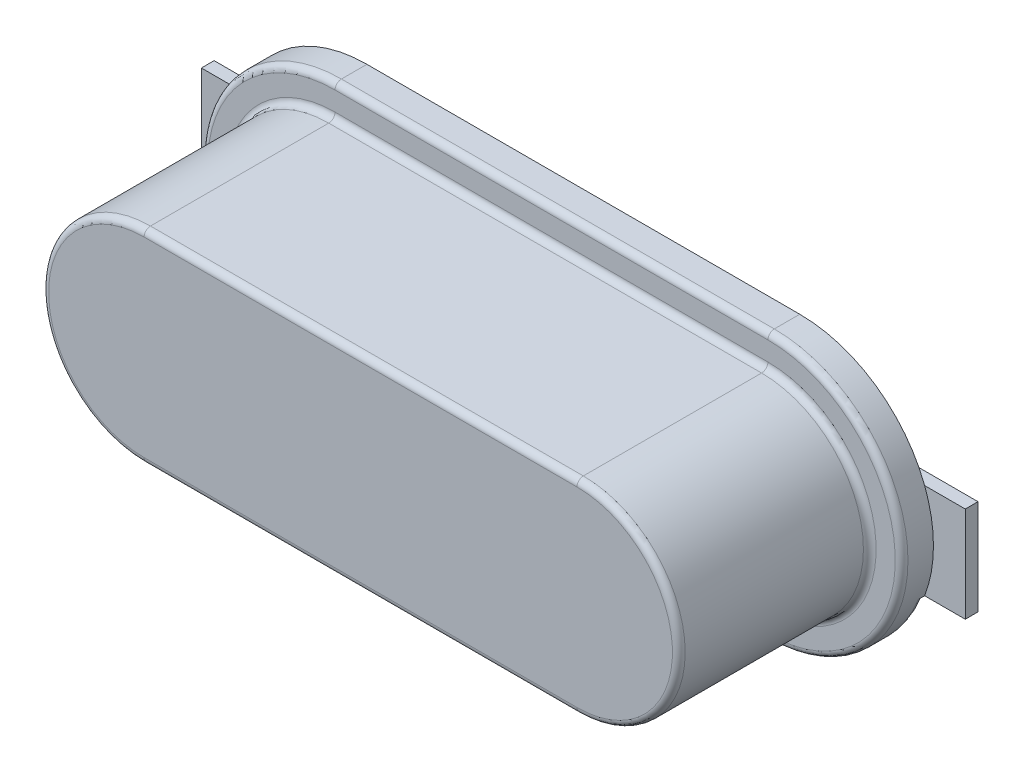
from build123d import *

# Parameters (mm, degrees)
EXTRUDE_1_DEPTH = 0.5
EXTRUDE_2_DEPTH = 3
SKETCH_3_W      = 3.5
SKETCH_3_H      = 1.5
EXTRUDE_3_DEPTH = 0.2
FILLET_1_R      = 0.1


with BuildPart() as part:
    # 草图1 → 凸台-拉伸1 (new body)
    with BuildSketch(Plane.XY):
        with BuildLine():
            Line((3.4, 2.1), (-3.4, 2.1))
            ThreePointArc((-3.4, 2.1), (-5.5, 0), (-3.4, -2.1))
            Line((-3.4, -2.1), (3.4, -2.1))
            ThreePointArc((3.4, -2.1), (5.5, 0), (3.4, 2.1))
        make_face()
    extrude(amount=EXTRUDE_1_DEPTH)

    # 草图2 → 凸台-拉伸2 (add)
    with BuildSketch(Plane.XY.offset(0.5)):
        with BuildLine():
            Line((-3.4, 1.6), (3.4, 1.6))
            ThreePointArc((3.4, 1.6), (5, 0), (3.4, -1.6))
            Line((3.4, -1.6), (-3.4, -1.6))
            ThreePointArc((-3.4, -1.6), (-5, 0), (-3.4, 1.6))
        make_face()
    extrude(amount=EXTRUDE_2_DEPTH)

    # 草图3 → 凸台-拉伸3 (add)
    with BuildSketch(Plane(origin=(0, 0, 0), x_dir=(-1, 0, 0), z_dir=(0, 0, -1))):
        with Locations((-4.25, 0)):
            Rectangle(SKETCH_3_W, SKETCH_3_H)
        with Locations((4.25, 0)):
            Rectangle(SKETCH_3_W, SKETCH_3_H)
    extrude(amount=EXTRUDE_3_DEPTH)

    # 圆角1
    # the kernel refuses this fillet: 0.1 mm, written as the material it adds along each edge
    with BuildSketch(Plane(origin=(3.4, 0, 0.5), x_dir=(0, 1, 0), z_dir=(-1, 0, 0))) as fillet_1_piece_1:
        with BuildLine():
            CenterArc((1.6 + FILLET_1_R, -FILLET_1_R), FILLET_1_R, 90, 90)
            Line((1.6, -FILLET_1_R), (1.6, 0))
            Line((1.6, 0), (1.6 + FILLET_1_R, 0))
        make_face()
    revolve(axis=Axis((3.4, 0, 0.5), (0, 0, -1)), revolution_arc=180)
    with BuildSketch(Plane(origin=(-3.4, 1.6, 0.5), x_dir=(0, 1, 0), z_dir=(1, 0, 0)), Plane(origin=(3.4, -1.6, 0.5), x_dir=(0, -1, 0), z_dir=(-1, 0, 0))) as fillet_1_piece_2:
        with BuildLine():
            CenterArc((FILLET_1_R, FILLET_1_R), FILLET_1_R, 180, 90)
            Line((0, FILLET_1_R), (0, 0))
            Line((0, 0), (FILLET_1_R, 0))
        make_face()
    extrude(amount=6.8)
    with BuildSketch(Plane(origin=(-3.4, 0, 0.5), x_dir=(0, -1, 0), z_dir=(1, 0, 0))) as fillet_1_piece_3:
        with BuildLine():
            CenterArc((1.6 + FILLET_1_R, -FILLET_1_R), FILLET_1_R, 90, 90)
            Line((1.6, -FILLET_1_R), (1.6, 0))
            Line((1.6, 0), (1.6 + FILLET_1_R, 0))
        make_face()
    revolve(axis=Axis((-3.4, 0, 0.5), (0, 0, -1)), revolution_arc=180)
    # the kernel refuses this fillet: 0.1 mm, written as the material it takes off along each edge
    with BuildSketch(Plane(origin=(-3.4, 0, 0.5), x_dir=(0, 1, 0), z_dir=(1, 0, 0))) as fillet_1_2_piece_1:
        with BuildLine():
            CenterArc((2.1 - FILLET_1_R, -FILLET_1_R), FILLET_1_R, 0, 90)
            Line((2.1 - FILLET_1_R, 0), (2.1, 0))
            Line((2.1, 0), (2.1, -FILLET_1_R))
        make_face()
    revolve(axis=Axis((-3.4, 0, 0.5), (0, 0, 1)), revolution_arc=180, mode=Mode.SUBTRACT)
    with BuildSketch(Plane(origin=(-3.4, -2.1, 0.5), x_dir=(0, 1, 0), z_dir=(1, 0, 0)), Plane(origin=(-3.4, 1.6, 3.5), x_dir=(0, 0, -1), z_dir=(1, 0, 0)), Plane(origin=(3.4, -1.6, 3.5), x_dir=(0, 0, -1), z_dir=(-1, 0, 0))) as fillet_1_2_piece_2:
        with BuildLine():
            CenterArc((FILLET_1_R, -FILLET_1_R), FILLET_1_R, 90, 90)
            Line((0, -FILLET_1_R), (0, 0))
            Line((0, 0), (FILLET_1_R, 0))
        make_face()
    extrude(amount=6.8, mode=Mode.SUBTRACT)
    with BuildSketch(Plane(origin=(3.4, 0, 3.5), x_dir=(0, 1, 0), z_dir=(-1, 0, 0))) as fillet_1_2_piece_3:
        with BuildLine():
            CenterArc((1.6 - FILLET_1_R, FILLET_1_R), FILLET_1_R, 270, 90)
            Line((1.6 - FILLET_1_R, 0), (1.6, 0))
            Line((1.6, 0), (1.6, FILLET_1_R))
        make_face()
    revolve(axis=Axis((3.4, 0, 3.5), (0, 0, -1)), revolution_arc=180, mode=Mode.SUBTRACT)
    with BuildSketch(Plane(origin=(-3.4, 0, 3.5), x_dir=(0, -1, 0), z_dir=(1, 0, 0))) as fillet_1_2_piece_4:
        with BuildLine():
            CenterArc((1.6 - FILLET_1_R, FILLET_1_R), FILLET_1_R, 270, 90)
            Line((1.6 - FILLET_1_R, 0), (1.6, 0))
            Line((1.6, 0), (1.6, FILLET_1_R))
        make_face()
    revolve(axis=Axis((-3.4, 0, 3.5), (0, 0, -1)), revolution_arc=180, mode=Mode.SUBTRACT)
    with BuildSketch(Plane(origin=(-3.4, 0, 0), x_dir=(-0.9698622672900031, -0.2436538168941636, 0), z_dir=(-0.2436538168941636, 0.9698622672900031, 0))) as fillet_1_2_piece_5_section:
        with BuildLine():
            CenterArc((2.1 - FILLET_1_R, FILLET_1_R), FILLET_1_R, 270, 90)
            Line((2.1 - FILLET_1_R, 0), (2.1, 0))
            Line((2.1, 0), (2.1, FILLET_1_R))
        make_face()
    fillet_1_2_piece_5 = revolve(axis=Axis((-3.4, 0, 0), (0, 0, 1)), revolution_arc=75.897707553, mode=Mode.PRIVATE)
    fillet_1_2_piece_5 = split(fillet_1_2_piece_5, bisect_by=Plane(origin=(-4.574684064, -0.75, 0.028052066), z_dir=(0, -1, 0)), keep=Keep.TOP, mode=Mode.PRIVATE)
    add(fillet_1_2_piece_5, mode=Mode.SUBTRACT)
    with BuildSketch(Plane(origin=(3.4, 0, 0.5), x_dir=(0, -1, 0), z_dir=(-1, 0, 0))) as fillet_1_2_piece_6:
        with BuildLine():
            CenterArc((2.1 - FILLET_1_R, -FILLET_1_R), FILLET_1_R, 0, 90)
            Line((2.1 - FILLET_1_R, 0), (2.1, 0))
            Line((2.1, 0), (2.1, -FILLET_1_R))
        make_face()
    revolve(axis=Axis((3.4, 0, 0.5), (0, 0, 1)), revolution_arc=180, mode=Mode.SUBTRACT)
    with BuildSketch(Plane(origin=(-3.4, -2.1, 0), x_dir=(0, 1, 0), z_dir=(1, 0, 0)), Plane(origin=(3.4, 2.1, 0.5), x_dir=(0, 0, -1), z_dir=(-1, 0, 0))) as fillet_1_2_piece_7:
        with BuildLine():
            CenterArc((FILLET_1_R, FILLET_1_R), FILLET_1_R, 180, 90)
            Line((0, FILLET_1_R), (0, 0))
            Line((0, 0), (FILLET_1_R, 0))
        make_face()
    extrude(amount=6.8, mode=Mode.SUBTRACT)
    with BuildSketch(Plane(origin=(3.4, 0, 0), x_dir=(0, -1, 0), z_dir=(-1, 0, 0))) as fillet_1_2_piece_8_section:
        with BuildLine():
            CenterArc((2.1 - FILLET_1_R, FILLET_1_R), FILLET_1_R, 270, 90)
            Line((2.1 - FILLET_1_R, 0), (2.1, 0))
            Line((2.1, 0), (2.1, FILLET_1_R))
        make_face()
    fillet_1_2_piece_8 = revolve(axis=Axis((3.4, 0, 0), (0, 0, 1)), revolution_arc=75.897707553, mode=Mode.PRIVATE)
    fillet_1_2_piece_8 = split(fillet_1_2_piece_8, bisect_by=Plane(origin=(4.574684074, -0.75, 0.028052047), z_dir=(0, -1, 0)), keep=Keep.TOP, mode=Mode.PRIVATE)
    add(fillet_1_2_piece_8, mode=Mode.SUBTRACT)


solid = part.part
